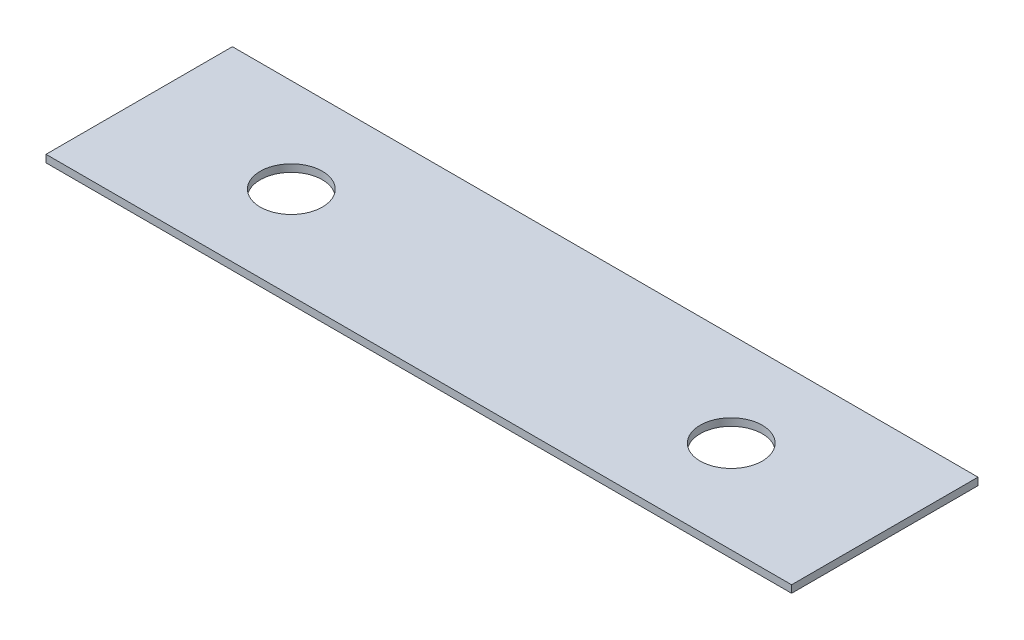
from build123d import *

# Parameters (mm, degrees)
SKETCH1_W           = 38.1
SKETCH1_H           = 1.51892
BOSS_EXTRUDE1_DEPTH = 152.4
CUT_EXTRUDE1_REACH  = 159.098
SKETCH2_R           = 6.35


with BuildPart() as part:
    # Sketch1 → Boss-Extrude1 (new body)
    with BuildSketch(Plane(origin=(0, 0, 0), x_dir=(0, 0, -1), z_dir=(1, 0, 0))):
        with Locations((19.05, 0.75946)):
            Rectangle(SKETCH1_W, SKETCH1_H)
    extrude(amount=BOSS_EXTRUDE1_DEPTH)

    # Sketch2 → Cut-Extrude1 (cut, up to next)
    with BuildSketch(Plane(origin=(0, 1.51892, 0), x_dir=(1, 0, 0), z_dir=(0, 1, 0)), mode=Mode.PRIVATE) as cut_extrude1_sk1:
        with Locations((31.242, 18.9)):
            Circle(SKETCH2_R)
    cut_extrude1_tool1 = extrude(cut_extrude1_sk1.sketch, amount=-CUT_EXTRUDE1_REACH, mode=Mode.PRIVATE) & part.part
    # Sketch2 → Cut-Extrude1 (cut, up to next)
    with BuildSketch(Plane(origin=(0, 1.51892, 0), x_dir=(1, 0, 0), z_dir=(0, 1, 0)), mode=Mode.PRIVATE) as cut_extrude1_sk2:
        with Locations((121.158, 18.9)):
            Circle(SKETCH2_R)
    cut_extrude1_tool2 = extrude(cut_extrude1_sk2.sketch, amount=-CUT_EXTRUDE1_REACH, mode=Mode.PRIVATE) & part.part
    add(cut_extrude1_tool1.solids().sort_by_distance((31.242, 1.51892, -18.9))[0], mode=Mode.SUBTRACT)
    add(cut_extrude1_tool2.solids().sort_by_distance((121.158, 1.51892, -18.9))[0], mode=Mode.SUBTRACT)


solid = part.part
